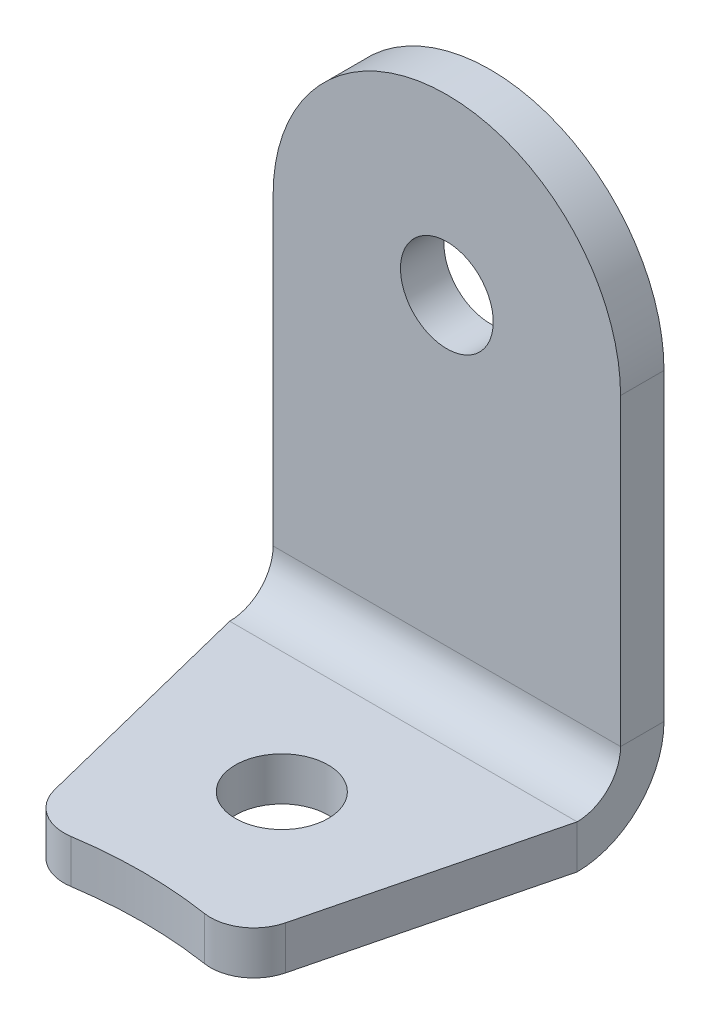
from build123d import *

# Parameters (mm, degrees)
SKETCH1_R          = 3.3909
BASE_FLANGE1_DEPTH = 3.175
EDGE_FLANGE1_DEPTH = 25.4
FILLET1_R          = 3.175
HOLE2_START        = -57.15
HOLE2_OUTLINE_R    = 3.3909
HOLE2_DEPTH        = 3.175
CUT_EXTRUDE1_DEPTH = 48.842508784


# Read off the part's stored shape, not the designer's step: Hole2
# Sheet-metal steps are written as plain solids
with BuildPart() as part:
    # Sketch1 → Base-Flange1 (new body)
    with BuildSketch(Plane(origin=(0, 0, 0), x_dir=(1, 0, 0), z_dir=(0, 1, 0))):
        with BuildLine():
            Line((-12.7, 50.8), (12.7, 50.8))
            Line((12.7, 50.8), (7.700506095, 30.80202438))
            ThreePointArc((7.700506095, 30.80202438), (0, 31.75), (-7.700506095, 30.80202438))
            Line((-7.700506095, 30.80202438), (-12.7, 50.8))
        make_face()
        with Locations(Location((0, 41.91, 0), (0, 0, 270))):
            Circle(SKETCH1_R, mode=Mode.SUBTRACT)
    extrude(amount=-BASE_FLANGE1_DEPTH)

    # Edge-Flange1 section (across the edge) → Edge-Flange1 (add)
    with BuildSketch(Plane(origin=(12.7, 0, -53.975), x_dir=(0, 0, 1), z_dir=(-1, 0, 0))):
        with BuildLine():
            Line((-3.175, 3.175), (-3.175, 38.227))
            Line((-3.175, 38.227), (0, 38.227))
            Line((0, 38.227), (0, 3.175))
            ThreePointArc((0, 3.175), (0.92993597, 0.92993597), (3.175, 0))
            Line((3.175, 0), (3.175, -3.175))
            ThreePointArc((3.175, -3.175), (-1.315128061, -1.315128061), (-3.175, 3.175))
        make_face()
    extrude(amount=EDGE_FLANGE1_DEPTH)

    # Fillet1
    fillet1_edges = [part.edges().sort_by_distance(p)[0] for p in [
        (7.700506095, -1.5875, -30.80202438),
        (-7.700506095, -1.5875, -30.80202438),
    ]]
    fillet(fillet1_edges, radius=FILLET1_R)

    # Hole2 outline → Hole2 (cut)
    with BuildSketch(Plane.XY.offset(HOLE2_START)):
        with Locations((0, 25.4)):
            Circle(HOLE2_OUTLINE_R)
    extrude(amount=HOLE2_DEPTH, mode=Mode.SUBTRACT)

    # Sketch11 → Cut-Extrude1 (cut, through all)
    with BuildSketch(Plane(origin=(0, 0, -57.15), x_dir=(-1, 0, 0), z_dir=(0, 0, -1))):
        with BuildLine():
            Line((-12.7, 25.4), (-12.7, 38.227))
            Line((-12.7, 38.227), (12.7, 38.227))
            Line((12.7, 38.227), (12.7, 25.4))
            ThreePointArc((12.7, 25.4), (0, 38.1), (-12.7, 25.4))
        make_face()
    extrude(amount=-CUT_EXTRUDE1_DEPTH, mode=Mode.SUBTRACT)


solid = part.part
